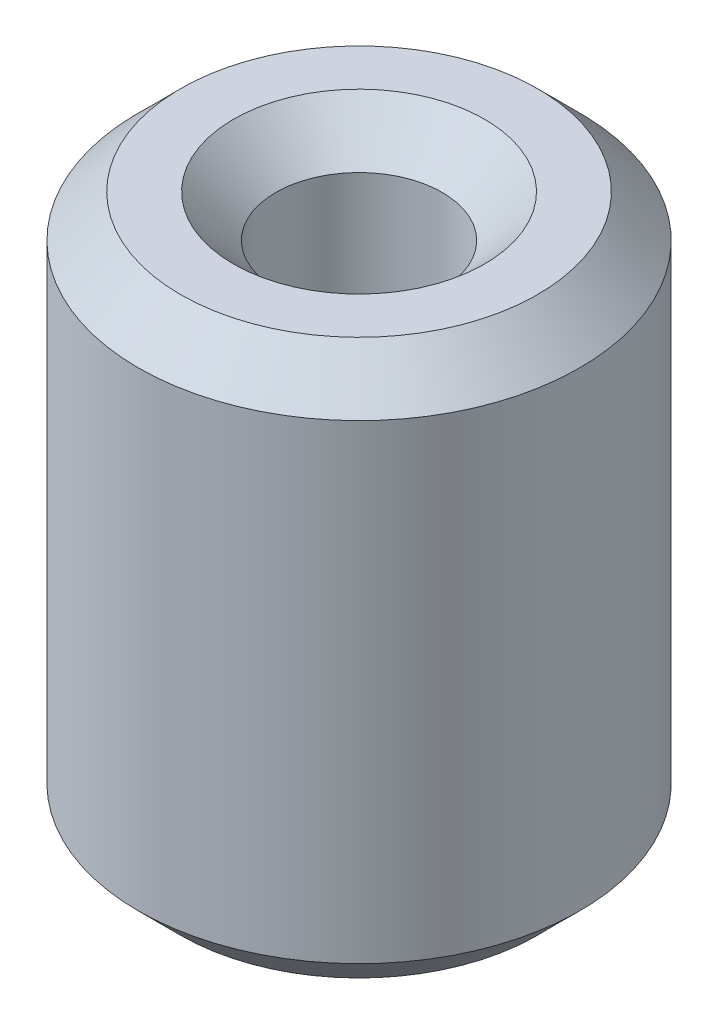
from build123d import *

# Parameters (mm, degrees)
SKETCH1_R           = 15
BOSS_EXTRUDE1_DEPTH = 37.707394118
SKETCH2_R           = 5.656004359
CUT_EXTRUDE1_DEPTH  = 44.264853763
CHAMFER1_SIZE       = 2.873255897


with BuildPart() as part:
    # Sketch1 → Boss-Extrude1 (new body)
    with BuildSketch(Plane(origin=(0, 0, 0), x_dir=(1, 0, 0), z_dir=(0, 1, 0))):
        Circle(SKETCH1_R)
    extrude(amount=BOSS_EXTRUDE1_DEPTH)

    # Sketch2 → Cut-Extrude1 (cut, through all)
    with BuildSketch(Plane(origin=(0, 0, 0), x_dir=(1, 0, 0), z_dir=(0, 1, 0))):
        Circle(SKETCH2_R)
    extrude(amount=CUT_EXTRUDE1_DEPTH, mode=Mode.SUBTRACT)

    # Chamfer1
    chamfer1_edges = [part.edges().sort_by_distance(p)[0] for p in [
        (-5.656004359, 37.707394118, 0),
        (-5.656004359, 0, 0),
        (-15, 0, 0),
        (-15, 37.707394118, 0),
    ]]
    chamfer(chamfer1_edges, length=CHAMFER1_SIZE)


solid = part.part
